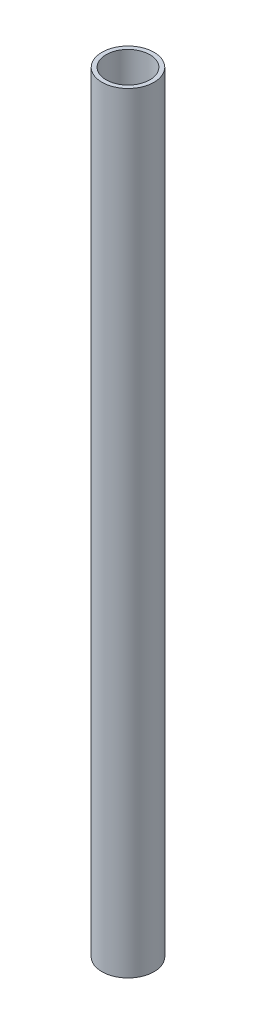
from build123d import *

# Parameters (mm, degrees)
SKETCH1_R           = 12.5
SKETCH1_R_2         = 10.5
BOSS_EXTRUDE1_DEPTH = 370


with BuildPart() as part:
    # Sketch1 → Boss-Extrude1 (new body)
    with BuildSketch(Plane(origin=(0, 0, 0), x_dir=(1, 0, 0), z_dir=(0, 1, 0))):
        Circle(SKETCH1_R)
        Circle(SKETCH1_R_2, mode=Mode.SUBTRACT)
    extrude(amount=BOSS_EXTRUDE1_DEPTH)


solid = part.part
